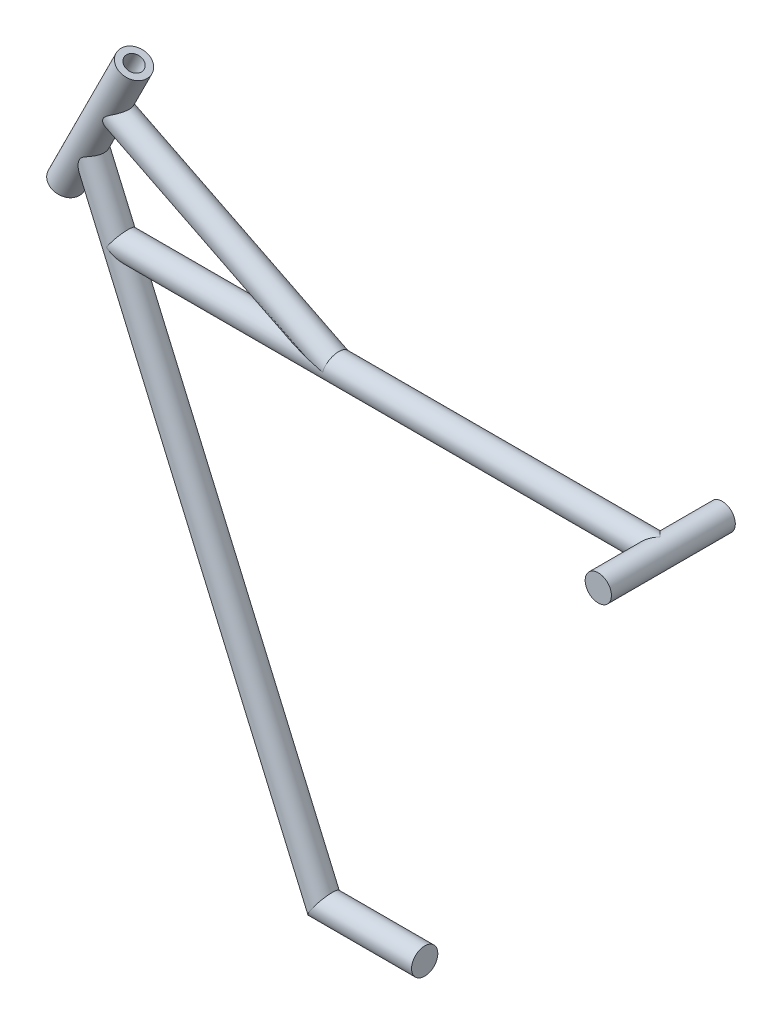
from build123d import *

# Parameters (mm, degrees)
SKETCH_1_R      = 15
SKETCH_1_R_2    = 8.537955809
EXTRUDE_1_DEPTH = 155
SKETCH_556_R    = 13.45
SKETCH_10_R     = 13.45
EXTRUDE_2_DEPTH = 63.45
SKETCH_12_R     = 13.45
SKETCH_14_R     = 13.45


with BuildPart() as part:
    # Эскиз1 → Бобышка-Вытянуть1 (new body)
    with BuildSketch(Plane(origin=(65.356683057, 130.567311509, 0), x_dir=(0.8942270422767364, -0.44761366920705176, 0), z_dir=(0.4476136692070517, 0.8942270422767363, 0))):
        with Locations((-752.46570076, 0)):
            Circle(SKETCH_1_R)
        with Locations((-752.46570076, 0)):
            Circle(SKETCH_1_R_2, mode=Mode.SUBTRACT)
    extrude(amount=EXTRUDE_1_DEPTH)

    # По траектории1: sweep along a path in Sketch 472
    with BuildLine(Plane.XY) as sweep_1_path:
        Line((-584.114970938, 511.769146541), (-344.355889763, -42.034285861))
        Line((-344.355889763, -42.034285861), (-240.471813863, -42.034285861))
    # Sketch 556 → По траектории1 (sweep)
    with BuildSketch(Plane(origin=(-240.471813863, 0, 0), x_dir=(0, 0, -1), z_dir=(1, 0, 0))):
        with Locations((0, -41.492835464)):
            Circle(SKETCH_556_R)
    sweep(path=sweep_1_path.line, transition=Transition.RIGHT)


with BuildPart() as body_2:
    # Эскиз10 → Бобышка-Вытянуть2 (new, symmetric)
    with BuildSketch(Plane.XY):
        with Locations((0.786530742, 441.860760967)):
            Circle(SKETCH_10_R)
    extrude(amount=EXTRUDE_2_DEPTH, both=True)

    # По траектории7: sweep along a path in Эскиз11
    with BuildLine(Plane.XY) as sweep_7_path:
        Line((0.786530742, 441.860760967), (-553.400108957, 441.860760967))
    # Эскиз12 → По траектории7 (sweep)
    with BuildSketch(Plane(origin=(0.786530742, 441.860760967, 0), x_dir=(0, 0, 1), z_dir=(-1, 0, 0))):
        Circle(SKETCH_12_R)
    sweep(path=sweep_7_path.line)

    # По траектории8: sweep along a path in Эскиз13
    with BuildLine(Plane.XY) as sweep_8_path:
        Line((-562.112349966, 557.28744747), (-331.516924554, 441.860760967))
    # Эскиз14 → По траектории8 (sweep)
    with BuildSketch(Plane(origin=(-331.516924554, 441.860760967, 0), x_dir=(0, 0, -1), z_dir=(0.8942270422767363, -0.4476136692070517, 0))):
        Circle(SKETCH_14_R)
    sweep(path=sweep_8_path.line)


solid = Compound([part.part, body_2.part])
